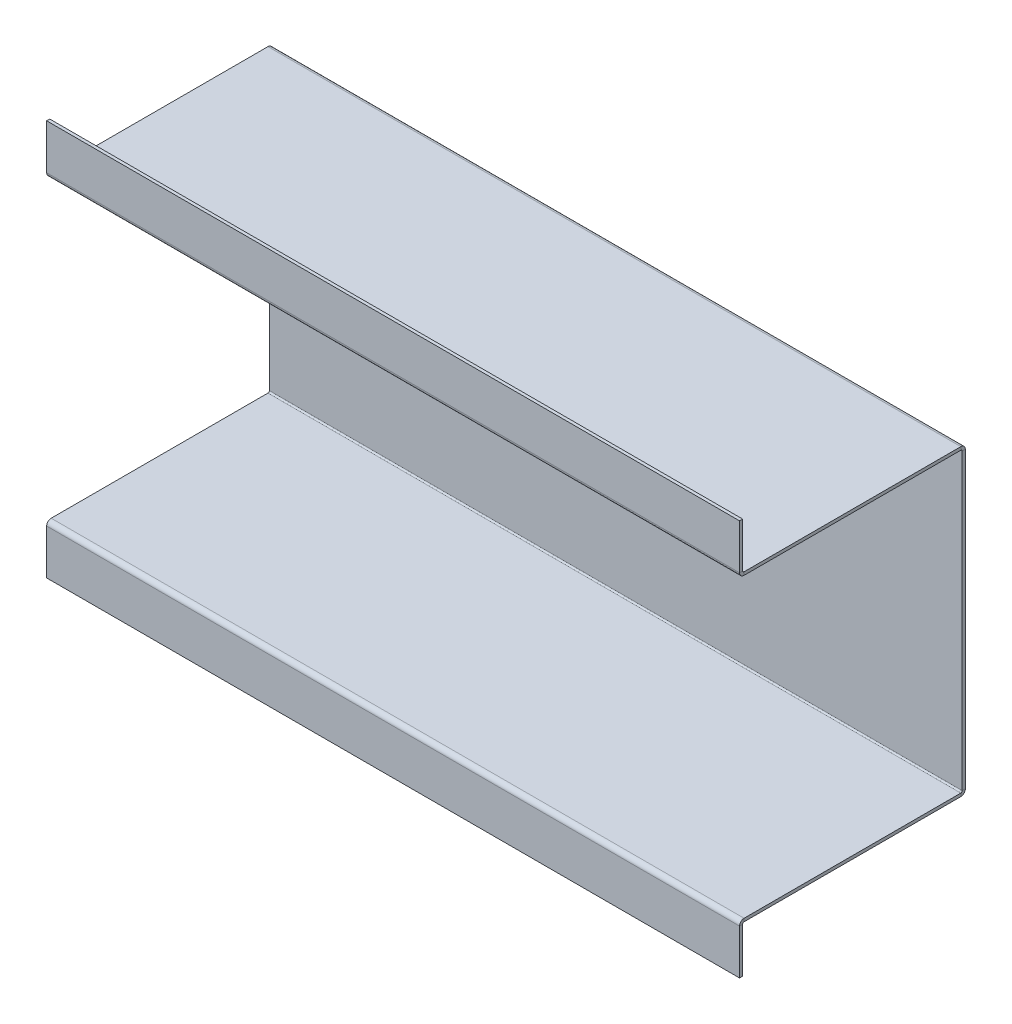
from build123d import *

# Parameters (mm, degrees)
SKETCH1_W                      = 1.5875
SKETCH1_H                      = 152.4
BASE_FLANGE1_DEPTH             = 355.6
EDGE_FLANGE1_STRIP_W           = 7.8232
EDGE_FLANGE1_STRIP_H           = 1.5875
EDGE_FLANGE1_STRIP_CUT_DEPTH   = 355.6
EDGE_FLANGE1_STRIP_2_W         = 7.8232
EDGE_FLANGE1_STRIP_2_H         = 1.5875
EDGE_FLANGE1_STRIP_CUT_2_DEPTH = 355.6
EDGE_FLANGE1_DEPTH             = 355.6
EDGE_FLANGE1_BEND_DEPTH        = 355.6
EDGE_FLANGE2_STRIP_W           = 7.8232
EDGE_FLANGE2_STRIP_H           = 1.5875
EDGE_FLANGE2_STRIP_CUT_DEPTH   = 355.6
EDGE_FLANGE2_STRIP_2_W         = 7.8232
EDGE_FLANGE2_STRIP_2_H         = 1.5875
EDGE_FLANGE2_STRIP_CUT_2_DEPTH = 355.6
EDGE_FLANGE2_DEPTH             = 355.6
EDGE_FLANGE2_BEND_DEPTH        = 355.6


# Sheet-metal steps are written as plain solids
with BuildPart() as part:
    # Sketch1 → Base-Flange1 (new body)
    with BuildSketch(Plane(origin=(0, 0, 0), x_dir=(0, 0, -1), z_dir=(1, 0, 0))):
        with Locations((0.79375, 76.2)):
            Rectangle(SKETCH1_W, SKETCH1_H)
    extrude(amount=BASE_FLANGE1_DEPTH)

    # Edge-Flange1 strip (across the edge) → Edge-Flange1 strip cut (cut)
    with BuildSketch(Plane(origin=(355.6, 152.4, 0), x_dir=(0, -1, 0), z_dir=(-1, 0, 0))):
        with Locations((-3.175, -0.79375)):
            Rectangle(EDGE_FLANGE1_STRIP_W, EDGE_FLANGE1_STRIP_H)
    extrude(amount=EDGE_FLANGE1_STRIP_CUT_DEPTH, mode=Mode.SUBTRACT)

    # Edge-Flange1 strip 2 (across the edge) → Edge-Flange1 strip cut 2 (cut)
    with BuildSketch(Plane.YZ):
        with Locations((-3.175, -0.79375)):
            Rectangle(EDGE_FLANGE1_STRIP_2_W, EDGE_FLANGE1_STRIP_2_H)
    extrude(amount=EDGE_FLANGE1_STRIP_CUT_2_DEPTH, mode=Mode.SUBTRACT)

    # Edge-Flange1 section (across the edge) → Edge-Flange1 (add)
    with BuildSketch(Plane(origin=(355.6, 152.4, 0), x_dir=(0, -1, 0), z_dir=(-1, 0, 0))):
        with BuildLine():
            Line((-1.5875, 0.7366), (-1.5875, 112.7125))
            Line((-1.5875, 112.7125), (0, 112.7125))
            Line((0, 112.7125), (0, 0.7366))
            ThreePointArc((0, 0.7366), (0.215745145, 0.215745145), (0.7366, 0))
            Line((0.7366, 0), (0.7366, -1.5875))
            ThreePointArc((0.7366, -1.5875), (-0.90678687, -0.90678687), (-1.5875, 0.7366))
        make_face()
    extrude(amount=EDGE_FLANGE1_DEPTH)

    # Edge-Flange1 section 2 (across the edge) → Edge-Flange1 bend (add)
    with BuildSketch(Plane.YZ):
        with BuildLine():
            Line((-1.5875, 0.7366), (-1.5875, 112.7125))
            Line((-1.5875, 112.7125), (0, 112.7125))
            Line((0, 112.7125), (0, 0.7366))
            ThreePointArc((0, 0.7366), (0.215745145, 0.215745145), (0.7366, 0))
            Line((0.7366, 0), (0.7366, -1.5875))
            ThreePointArc((0.7366, -1.5875), (-0.90678687, -0.90678687), (-1.5875, 0.7366))
        make_face()
    extrude(amount=EDGE_FLANGE1_BEND_DEPTH)

    # Edge-Flange2 strip (across the edge) → Edge-Flange2 strip cut (cut)
    with BuildSketch(Plane(origin=(0, 153.9875, 112.7125), x_dir=(0, 0, -1), z_dir=(1, 0, 0))):
        with Locations((-3.175, -0.79375)):
            Rectangle(EDGE_FLANGE2_STRIP_W, EDGE_FLANGE2_STRIP_H)
    extrude(amount=EDGE_FLANGE2_STRIP_CUT_DEPTH, mode=Mode.SUBTRACT)

    # Edge-Flange2 strip 2 (across the edge) → Edge-Flange2 strip cut 2 (cut)
    with BuildSketch(Plane(origin=(355.6, -1.5875, 112.7125), x_dir=(0, 0, -1), z_dir=(-1, 0, 0))):
        with Locations((-3.175, -0.79375)):
            Rectangle(EDGE_FLANGE2_STRIP_2_W, EDGE_FLANGE2_STRIP_2_H)
    extrude(amount=EDGE_FLANGE2_STRIP_CUT_2_DEPTH, mode=Mode.SUBTRACT)

    # Edge-Flange2 section (across the edge) → Edge-Flange2 (add)
    with BuildSketch(Plane(origin=(0, 153.9875, 112.7125), x_dir=(0, 0, -1), z_dir=(1, 0, 0))):
        with BuildLine():
            Line((-1.5875, 0.7366), (-1.5875, 23.8125))
            Line((-1.5875, 23.8125), (0, 23.8125))
            Line((0, 23.8125), (0, 0.7366))
            ThreePointArc((0, 0.7366), (0.215745145, 0.215745145), (0.7366, 0))
            Line((0.7366, 0), (0.7366, -1.5875))
            ThreePointArc((0.7366, -1.5875), (-0.90678687, -0.90678687), (-1.5875, 0.7366))
        make_face()
    extrude(amount=EDGE_FLANGE2_DEPTH)

    # Edge-Flange2 section 2 (across the edge) → Edge-Flange2 bend (add)
    with BuildSketch(Plane(origin=(355.6, -1.5875, 112.7125), x_dir=(0, 0, -1), z_dir=(-1, 0, 0))):
        with BuildLine():
            Line((-1.5875, 0.7366), (-1.5875, 23.8125))
            Line((-1.5875, 23.8125), (0, 23.8125))
            Line((0, 23.8125), (0, 0.7366))
            ThreePointArc((0, 0.7366), (0.215745145, 0.215745145), (0.7366, 0))
            Line((0.7366, 0), (0.7366, -1.5875))
            ThreePointArc((0.7366, -1.5875), (-0.90678687, -0.90678687), (-1.5875, 0.7366))
        make_face()
    extrude(amount=EDGE_FLANGE2_BEND_DEPTH)


solid = part.part
